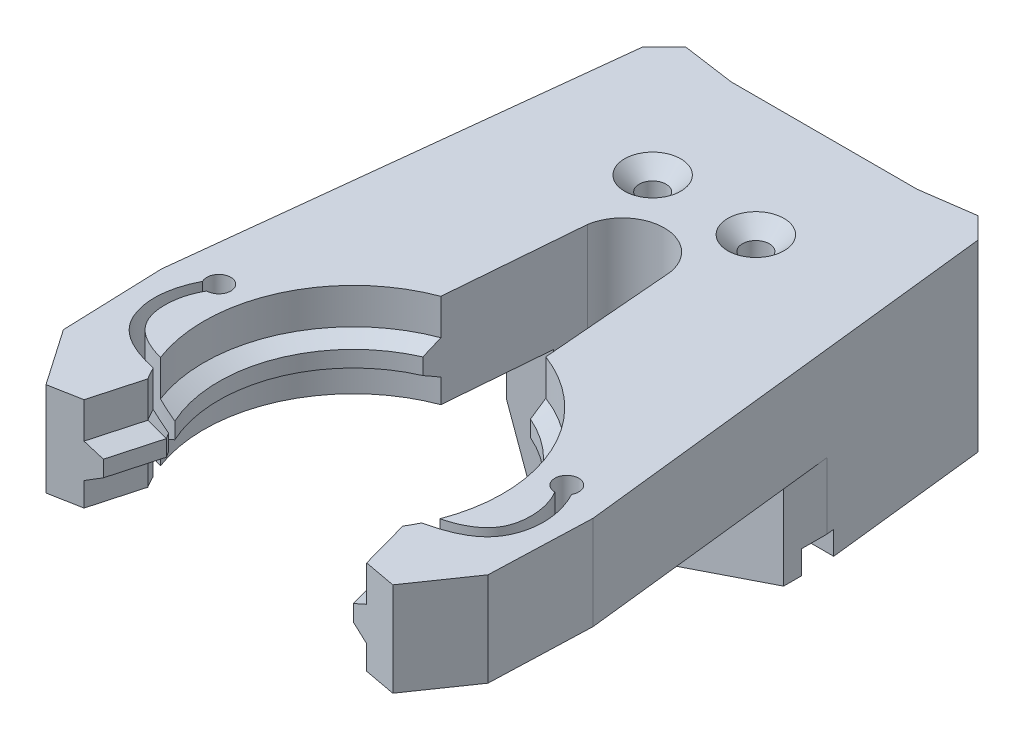
from build123d import *
from OCP.BRepFilletAPI import BRepFilletAPI_MakeChamfer

# Parameters (mm, degrees)
EXTRUDE_1_DEPTH                                 = 15.7
CUT_EXTRUDE_5_DEPTH                             = 6
CUT_EXTRUDE_START                               = -4
CUT_EXTRUDE_6_DEPTH                             = 4
CHAMFER_2_SIZE                                  = 2.5
CHAMFER_2_SIZE_2                                = 1.5
CHAMFER_3_SIZE                                  = 2.5
CHAMFER_3_SIZE_2                                = 1.5
CHAMFER_4_SIZE                                  = 2.5
CHAMFER_4_SIZE_2                                = 1.5
CHAMFER_5_SIZE                                  = 1.5
CHAMFER_5_SIZE_2                                = 2.5
CUT_EXTRUDE_7_DEPTH                             = 20
BOSS_EXTRUDE2_DEPTH                             = 15
CSK_FOR_M4_FLAT_HEAD_MACHINE_SCREW1_D           = 4.5
CSK_FOR_M4_FLAT_HEAD_MACHINE_SCREW1_DEPTH       = 28.648063607
CSK_FOR_M4_FLAT_HEAD_MACHINE_SCREW1_CSINK_D     = 9.4
CSK_FOR_M4_FLAT_HEAD_MACHINE_SCREW1_CSINK_ANGLE = 90
CSK_FOR_M4_FLAT_HEAD_MACHINE_SCREW1_TIP         = 1.351936393
BOSS_EXTRUDE3_DEPTH                             = 3
BOSS_EXTRUDE3_DEPTH_BACK                        = 4.283096
CUT_EXTRUDE1_DEPTH                              = 122.536445899
CUT_EXTRUDE2_START                              = -5
CUT_EXTRUDE2_DEPTH                              = 5
CHAMFER1_SIZE                                   = 5
CUT_EXTRUDE3_REACH                              = 94.592
SKETCH9_R                                       = 2


with BuildPart() as part:
    # Эскиз1 → Бобышка-Вытянуть1 (new body)
    with BuildSketch(Plane(origin=(0, 0, 0), x_dir=(1, 0, 0), z_dir=(0, 1, 0))):
        with BuildLine():
            Line((19, -55.842875467), (21.087010541, -30.364203971))
            ThreePointArc((21.087010541, -30.364203971), (28, -24.464466094), (34.912989459, -30.364203971))
            Line((34.912989459, -30.364203971), (37, -55.842875467))
            ThreePointArc((37, -55.842875467), (49.615065571, -70.216351148), (46.614482007, -89.103732671))
            Line((46.614482007, -89.103732671), (48.9, -97.364070254))
            Line((48.9, -97.364070254), (57, -98.864070254))
            Line((57, -98.864070254), (63.5, -89.453874559))
            Line((63.5, -89.453874559), (64.1, -72.464466094))
            Line((64.1, -72.464466094), (56, 0))
            Line((56, 0), (52.464466094, 3.535533906))
            Line((52.464466094, 3.535533906), (43.553055011, 2.275870258))
            Line((43.553055011, 2.275870258), (12.446944989, 2.275870258))
            Line((12.446944989, 2.275870258), (3.535533906, 3.535533906))
            Line((3.535533906, 3.535533906), (0, 0))
            Line((0, 0), (-8.1, -72.464466094))
            Line((-8.1, -72.464466094), (-7.5, -89.453874559))
            Line((-7.5, -89.453874559), (-1, -98.864070254))
            Line((-1, -98.864070254), (7.1, -97.364070254))
            Line((7.1, -97.364070254), (9.385517993, -89.103732671))
            ThreePointArc((9.385517993, -89.103732671), (6.384934429, -70.216351148), (19, -55.842875467))
        make_face()
    extrude(amount=EXTRUDE_1_DEPTH)

    # Эскиз9 → Вырез-Вытянуть5 (cut)
    with BuildSketch(Plane(origin=(0, 15.7, 0), x_dir=(1, 0, 0), z_dir=(0, 1, 0))):
        with BuildLine():
            Line((4.070420212, -98.938601985), (6.67745221, -89.516245887))
            ThreePointArc((6.67745221, -89.516245887), (28, -51.464466094), (49.32254779, -89.516245887))
            Line((49.32254779, -89.516245887), (51.928879153, -98.936069744))
            Line((51.928879153, -98.936069744), (4.070420212, -98.938601985))
        make_face()
    extrude(amount=-CUT_EXTRUDE_5_DEPTH, mode=Mode.SUBTRACT)

    # Эскиз10 → Вырез-Вытянуть6 (cut)
    with BuildSketch(Plane.XZ.offset(CUT_EXTRUDE_START)):
        with BuildLine():
            Line((49.32254779, 89.516245887), (52.714892846, 101.77688678))
            Line((52.714892846, 101.77688678), (2.982429051, 102.870828422))
            Line((2.982429051, 102.870828422), (6.67745221, 89.516245887))
            ThreePointArc((6.67745221, 89.516245887), (28, 51.464466094), (49.32254779, 89.516245887))
        make_face()
    extrude(amount=CUT_EXTRUDE_6_DEPTH, mode=Mode.SUBTRACT)

    # Фаска2
    chamfer_2_edges_1 = [part.edges().sort_by_distance(p)[0] for p in [
        (8.242758997, 9.7, 93.233901463),
    ]]
    chamfer_2_side_1 = [part.faces().sort_by_distance(p)[0] for p in [
        (8.213845332, 9.7, 93.225901463),
    ]]
    chamfer_2_edges_2 = [part.edges().sort_by_distance(p)[0] for p in [
        (6.384934429, 9.7, 70.216351148),
    ]]
    chamfer_2_side_2 = [part.faces().sort_by_distance(p)[0] for p in [
        (6.356114342, 9.7, 70.208020328),
    ]]
    chamfer_2 = BRepFilletAPI_MakeChamfer(part.part.solid().wrapped)
    for e in chamfer_2_edges_1:
        chamfer_2.Add(CHAMFER_2_SIZE - 0.0001, CHAMFER_2_SIZE_2 - 0.0001, e.wrapped, chamfer_2_side_1[0].wrapped)
    for e in chamfer_2_edges_2:
        chamfer_2.Add(CHAMFER_2_SIZE - 0.0001, CHAMFER_2_SIZE_2 - 0.0001, e.wrapped, chamfer_2_side_2[0].wrapped)
    add(Compound.cast(chamfer_2.Shape()), mode=Mode.REPLACE)  # a hair under: the kernel refuses the full size

    # Фаска3
    chamfer_3_edges_1 = [part.edges().sort_by_distance(p)[0] for p in [
        (8.242758997, 4, 93.233901463),
    ]]
    chamfer_3_side_1 = [part.faces().sort_by_distance(p)[0] for p in [
        (8.213845332, 4, 93.225901463),
    ]]
    chamfer_3_edges_2 = [part.edges().sort_by_distance(p)[0] for p in [
        (6.384934429, 4, 70.216351148),
    ]]
    chamfer_3_side_2 = [part.faces().sort_by_distance(p)[0] for p in [
        (6.384934429, 4.03, 70.216351148),
    ]]
    chamfer_3 = BRepFilletAPI_MakeChamfer(part.part.solid().wrapped)
    for e in chamfer_3_edges_1:
        chamfer_3.Add(CHAMFER_3_SIZE - 0.0001, CHAMFER_3_SIZE_2 - 0.0001, e.wrapped, chamfer_3_side_1[0].wrapped)
    for e in chamfer_3_edges_2:
        chamfer_3.Add(CHAMFER_3_SIZE_2 - 0.0001, CHAMFER_3_SIZE - 0.0001, e.wrapped, chamfer_3_side_2[0].wrapped)
    add(Compound.cast(chamfer_3.Shape()), mode=Mode.REPLACE)  # a hair under: the kernel refuses the full size

    # Фаска4
    chamfer_4_edges_1 = [part.edges().sort_by_distance(p)[0] for p in [
        (47.757241003, 9.7, 93.233901463),
    ]]
    chamfer_4_side_1 = [part.faces().sort_by_distance(p)[0] for p in [
        (47.786154668, 9.7, 93.225901463),
    ]]
    chamfer_4_edges_2 = [part.edges().sort_by_distance(p)[0] for p in [
        (49.615065571, 9.7, 70.216351148),
    ]]
    chamfer_4_side_2 = [part.faces().sort_by_distance(p)[0] for p in [
        (49.643885658, 9.7, 70.208020328),
    ]]
    chamfer_4 = BRepFilletAPI_MakeChamfer(part.part.solid().wrapped)
    for e in chamfer_4_edges_1:
        chamfer_4.Add(CHAMFER_4_SIZE - 0.0001, CHAMFER_4_SIZE_2 - 0.0001, e.wrapped, chamfer_4_side_1[0].wrapped)
    for e in chamfer_4_edges_2:
        chamfer_4.Add(CHAMFER_4_SIZE - 0.0001, CHAMFER_4_SIZE_2 - 0.0001, e.wrapped, chamfer_4_side_2[0].wrapped)
    add(Compound.cast(chamfer_4.Shape()), mode=Mode.REPLACE)  # a hair under: the kernel refuses the full size

    # Фаска5
    chamfer_5_edges_1 = [part.edges().sort_by_distance(p)[0] for p in [
        (47.757241003, 4, 93.233901463),
    ]]
    chamfer_5_side_1 = [part.faces().sort_by_distance(p)[0] for p in [
        (47.757241003, 4.03, 93.233901463),
    ]]
    chamfer_5_edges_2 = [part.edges().sort_by_distance(p)[0] for p in [
        (49.615065571, 4, 70.216351148),
    ]]
    chamfer_5_side_2 = [part.faces().sort_by_distance(p)[0] for p in [
        (49.643885658, 4, 70.208020328),
    ]]
    chamfer_5 = BRepFilletAPI_MakeChamfer(part.part.solid().wrapped)
    for e in chamfer_5_edges_1:
        chamfer_5.Add(CHAMFER_5_SIZE - 0.0001, CHAMFER_5_SIZE_2 - 0.0001, e.wrapped, chamfer_5_side_1[0].wrapped)
    for e in chamfer_5_edges_2:
        chamfer_5.Add(CHAMFER_5_SIZE_2 - 0.0001, CHAMFER_5_SIZE - 0.0001, e.wrapped, chamfer_5_side_2[0].wrapped)
    add(Compound.cast(chamfer_5.Shape()), mode=Mode.REPLACE)  # a hair under: the kernel refuses the full size

    # Эскиз11 → Вырез-Вытянуть7 (cut)
    with BuildSketch(Plane(origin=(0, 15.7, 0), x_dir=(1, 0, 0), z_dir=(0, 1, 0))):
        with BuildLine():
            Line((46.426049473, -86.017959352), (46.012822205, -88.379258027))
            add(Edge.make_bspline(
                [(58.862726543, -70.808948625), (60.119619749, -73.228227212), (61.202001727, -77.673197621), (57.883666669, -86.609034293), (49.905997231, -87.608281842), (46.012822205, -88.379258027)],
                knots=[0, 0, 0, 0, 0.305163468, 0.487677304, 1, 1, 1, 1], degree=3))
            ThreePointArc((58.862726543, -70.808948625), (56.072808864, -68.148005462), (57.1, -71.864070254))
            add(Edge.make_bspline(
                [(57.1, -71.864070254), (58.73856603, -74.489449168), (59.890065943, -84.15910166), (49.798382886, -85.957388163), (46.426049473, -86.017959352)],
                knots=[0, 0, 0, 0, 0.454203244, 1, 1, 1, 1], degree=3))
        make_face()
        with BuildLine():
            Line((9.573950527, -86.017959352), (9.987177795, -88.379258027))
            add(Edge.make_bspline(
                [(-2.862726543, -70.808948625), (-4.119619749, -73.228227212), (-5.202001727, -77.673197621), (-1.883666669, -86.609034293), (6.094002769, -87.608281842), (9.987177795, -88.379258027)],
                knots=[0, 0, 0, 0, 0.305163468, 0.487677304, 1, 1, 1, 1], degree=3))
            ThreePointArc((-2.862726543, -70.808948625), (-0.072808864, -68.148005462), (-1.1, -71.864070254))
            add(Edge.make_bspline(
                [(-1.1, -71.864070254), (-2.73856603, -74.489449168), (-3.890065943, -84.15910166), (6.201617114, -85.957388163), (9.573950527, -86.017959352)],
                knots=[0, 0, 0, 0, 0.454203244, 1, 1, 1, 1], degree=3))
        make_face()
    extrude(amount=-CUT_EXTRUDE_7_DEPTH, mode=Mode.SUBTRACT)

    # Sketch5 → Boss-Extrude2 (add)
    with BuildSketch(Plane.XZ):
        Polygon((3.535533906, -3.535533906), (0, 0), (-3.078509959, 27.541059326), (12.727631466, 30.166723248), (28.000118409, 31.014994944), (59.173331778, 28.389357167), (56, 0), (52.464466094, -3.535533906), (43.553055011, -2.275870258), (12.446944989, -2.275870258), align=None)
    extrude(amount=BOSS_EXTRUDE2_DEPTH)

    # CSK for M4 Flat Head Machine Screw1
    with Locations(Plane(origin=(19.370167772, 15.7, 17.779382006), x_dir=(0, 0, 1), z_dir=(0, 1, 0))):
        with Locations((0, 0), (0, 17.26)):
            CounterSinkHole(CSK_FOR_M4_FLAT_HEAD_MACHINE_SCREW1_D / 2, CSK_FOR_M4_FLAT_HEAD_MACHINE_SCREW1_CSINK_D / 2, depth=CSK_FOR_M4_FLAT_HEAD_MACHINE_SCREW1_DEPTH, counter_sink_angle=CSK_FOR_M4_FLAT_HEAD_MACHINE_SCREW1_CSINK_ANGLE)
            with Locations((0, 0, -(CSK_FOR_M4_FLAT_HEAD_MACHINE_SCREW1_DEPTH + CSK_FOR_M4_FLAT_HEAD_MACHINE_SCREW1_TIP / 2))):  # 118° drill point
                Cone(0, CSK_FOR_M4_FLAT_HEAD_MACHINE_SCREW1_D / 2, CSK_FOR_M4_FLAT_HEAD_MACHINE_SCREW1_TIP, mode=Mode.SUBTRACT)

    # Sketch6 → Boss-Extrude3 (add, two sides: drawn at the far end of the back side and taken through both)
    with BuildSketch(Plane.XY.offset(32.6724529).offset(-BOSS_EXTRUDE3_DEPTH_BACK)):
        Polygon((12.822450363, -11.082801181), (12.822450363, 0), (59.173331778, 0), (59.173331778, -15), (39.425133125, -21.709493147), (16.66992259, -21.709493147), align=None)
    extrude(amount=BOSS_EXTRUDE3_DEPTH + BOSS_EXTRUDE3_DEPTH_BACK)

    # Sketch7 → Cut-Extrude1 (cut, through all)
    with BuildSketch(Plane(origin=(59.173331778, 0, 0), x_dir=(0, 0, -1), z_dir=(1, 0, 0))):
        Polygon((-32.6724529, -22.263045792), (-32.6724529, -12.082801181), (-32.6724529, -11.082801181), (-31.6724529, -11.082801181), (-27.1724529, -11.082801181), (-27.1724529, -22.263045792), align=None)
    extrude(amount=-CUT_EXTRUDE1_DEPTH, mode=Mode.SUBTRACT)

    # Sketch8 → Cut-Extrude2 (cut)
    with BuildSketch(Plane(origin=(0, 0, 0), x_dir=(1, 0, 0), z_dir=(0, 1, 0)).offset(CUT_EXTRUDE2_START)):
        with BuildLine():
            Line((35.347799079, -35.6724529), (34.912989459, -30.364203971))
            ThreePointArc((34.912989459, -30.364203971), (28, -24.464466094), (21.087010541, -30.364203971))
            Line((21.087010541, -30.364203971), (20.652200921, -35.6724529))
            Line((20.652200921, -35.6724529), (35.347799079, -35.6724529))
        make_face()
    extrude(amount=CUT_EXTRUDE2_DEPTH, mode=Mode.SUBTRACT)

    # Chamfer1
    chamfer1_edges = [part.edges().sort_by_distance(p)[0] for p in [
        (28, -5, 35.6724529),
    ]]
    chamfer(chamfer1_edges, length=CHAMFER1_SIZE)

    # Sketch9 → Cut-Extrude3 (cut, up to next)
    with BuildSketch(Plane.XY.offset(35.6724529), mode=Mode.PRIVATE) as cut_extrude3_sk1:
        with Locations((28.047527858, -16.709493147)):
            Circle(SKETCH9_R)
    cut_extrude3_tool1 = extrude(cut_extrude3_sk1.sketch, amount=-CUT_EXTRUDE3_REACH, mode=Mode.PRIVATE) & part.part
    add(cut_extrude3_tool1.solids().sort_by_distance((28.047528, -16.709493, 35.672453))[0], mode=Mode.SUBTRACT)


solid = part.part
